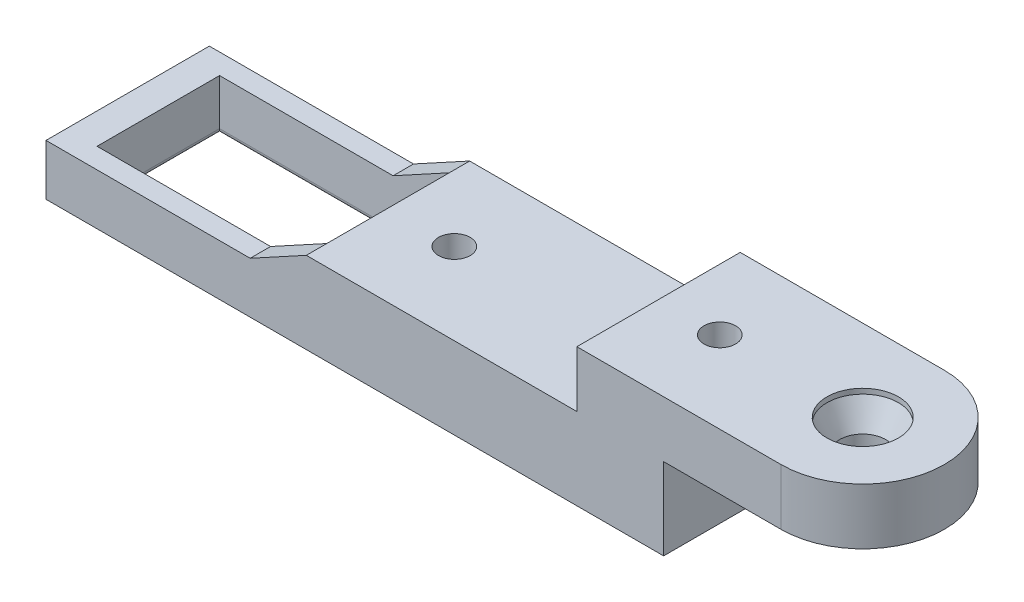
from build123d import *
from OCP.BRepFilletAPI import BRepFilletAPI_MakeChamfer

# Parameters (mm, degrees)
SKETCH1_W               = 34.25
SKETCH1_H               = 16
SKETCH1_W_2             = 22.5
SKETCH1_H_2             = 12
BOSS_EXTRUDE2_DEPTH     = 5
SKETCH4_W               = 16
SKETCH4_H               = 5
BOSS_EXTRUDE3_DEPTH     = 2
BOSS_EXTRUDE4_DEPTH     = 3
SKETCH6_R               = 1.55
CUT_EXTRUDE1_DEPTH      = 3.5
FILLET1_R               = 0.5
SKETCH8_W               = 25.75
SKETCH8_H               = 16
BOSS_EXTRUDE5_DEPTH     = 8
SKETCH9_W               = 10
SKETCH9_H               = 16
BOSS_EXTRUDE6_DEPTH     = 5.5
SKETCH10_R              = 1.55
CUT_EXTRUDE2_DEPTH      = 3.5
SKETCH11_W              = 16
SKETCH11_H              = 5.5
BOSS_EXTRUDE7_DEPTH     = 20
CUT_EXTRUDE3_DEPTH      = 70.543601431
CUT_EXTRUDE3_DEPTH_BACK = 70.543601431
SKETCH12_R              = 2.25
SKETCH13_R              = 3.5
CUT_EXTRUDE4_DEPTH      = 3
SKETCH14_W              = 1.5
SKETCH14_H              = 8
CUT_EXTRUDE5_DEPTH      = 70.002264456
CHAMFER1_SIZE2          = 1.25
CHAMFER1_SIZE           = 2.5
CHAMFER2_SIZE           = 5.5
CHAMFER2_SIZE_2         = 3


with BuildPart() as part:
    # Sketch1 → Boss-Extrude2 (new body)
    with BuildSketch(Plane(origin=(0, 0, 0), x_dir=(1, 0, 0), z_dir=(0, 1, 0))):
        with Locations((2.875, 0)):
            Rectangle(SKETCH1_W, SKETCH1_H)
        Rectangle(SKETCH1_W_2, SKETCH1_H_2, mode=Mode.SUBTRACT)
    extrude(amount=BOSS_EXTRUDE2_DEPTH)

    # Sketch4 → Boss-Extrude3 (add)
    with BuildSketch(Plane(origin=(20, 0, 0), x_dir=(0, 0, -1), z_dir=(1, 0, 0))):
        with Locations((0, 2.5)):
            Rectangle(SKETCH4_W, SKETCH4_H)
    extrude(amount=BOSS_EXTRUDE3_DEPTH)

    # Sketch3 → Boss-Extrude4 (add)
    with BuildSketch(Plane(origin=(0, 5, 0), x_dir=(1, 0, 0), z_dir=(0, 1, 0))):
        Polygon((5.75, 6), (11.25, 6), (11.25, -6), (5.75, -6), (5.75, -8), (22, -8), (22, 8), (5.75, 8), align=None)
    extrude(amount=BOSS_EXTRUDE4_DEPTH)

    # Sketch6 → Cut-Extrude1 (cut)
    with BuildSketch(Plane(origin=(0, 8, 0), x_dir=(1, 0, 0), z_dir=(0, 1, 0))):
        with Locations(Location((17.75, 0, 0), (0, 0, 270))):
            Circle(SKETCH6_R)
    extrude(amount=-CUT_EXTRUDE1_DEPTH, mode=Mode.SUBTRACT)

    # Fillet1
    fillet1_edges = [part.edges().sort_by_distance(p)[0] for p in [
        (11.25, 0, 0),
        (0, 0, -6),
        (-11.25, 0, 0),
        (0, 0, 6),
    ]]
    fillet(fillet1_edges, radius=FILLET1_R)

    # Sketch8 → Boss-Extrude5 (add)
    with BuildSketch(Plane(origin=(0, 8, 0), x_dir=(1, 0, 0), z_dir=(0, 1, 0))):
        with Locations((34.875, 0)):
            Rectangle(SKETCH8_W, SKETCH8_H)
    extrude(amount=-BOSS_EXTRUDE5_DEPTH)

    # Sketch9 → Boss-Extrude6 (add)
    with BuildSketch(Plane(origin=(0, 8, 0), x_dir=(1, 0, 0), z_dir=(0, 1, 0))):
        with Locations((42.75, 0)):
            Rectangle(SKETCH9_W, SKETCH9_H)
    extrude(amount=BOSS_EXTRUDE6_DEPTH)

    # Sketch10 → Cut-Extrude2 (cut)
    with BuildSketch(Plane(origin=(0, 13.5, 0), x_dir=(1, 0, 0), z_dir=(0, 1, 0))):
        with Locations(Location((43.75, 0, 0), (0, 0, 270))):
            Circle(SKETCH10_R)
    extrude(amount=-CUT_EXTRUDE2_DEPTH, mode=Mode.SUBTRACT)

    # Sketch11 → Boss-Extrude7 (add)
    with BuildSketch(Plane(origin=(47.75, 0, 0), x_dir=(0, 0, -1), z_dir=(1, 0, 0))):
        with Locations((0, 10.75)):
            Rectangle(SKETCH11_W, SKETCH11_H)
    extrude(amount=BOSS_EXTRUDE7_DEPTH)

    # Sketch12 → Cut-Extrude3 (cut, two sides: drawn at the far end of the back side and taken through both)
    with BuildSketch(Plane(origin=(0, 13.5, 0), x_dir=(1, 0, 0), z_dir=(0, 1, 0)).offset(-CUT_EXTRUDE3_DEPTH_BACK)):
        with Locations(Location((57.75, 0, 0), (0, 0, 270))):
            Circle(SKETCH12_R)
        with BuildLine():
            Line((57.75, 8), (67.75, 8))
            Line((67.75, 8), (67.75, -8))
            Line((67.75, -8), (57.75, -8))
            ThreePointArc((57.75, -8), (65.75, 0), (57.75, 8))
        make_face()
    extrude(amount=CUT_EXTRUDE3_DEPTH + CUT_EXTRUDE3_DEPTH_BACK, mode=Mode.SUBTRACT)

    # Sketch13 → Cut-Extrude4 (cut)
    with BuildSketch(Plane(origin=(0, 13.5, 0), x_dir=(1, 0, 0), z_dir=(0, 1, 0))):
        with Locations(Location((57.75, 0, 0), (0, 0, 270))):
            Circle(SKETCH13_R)
    extrude(amount=-CUT_EXTRUDE4_DEPTH, mode=Mode.SUBTRACT)

    # Sketch14 → Cut-Extrude5 (cut, through all)
    with BuildSketch(Plane(origin=(0, 0, -8), x_dir=(-1, 0, 0), z_dir=(0, 0, -1))):
        with Locations((-47, 4)):
            Rectangle(SKETCH14_W, SKETCH14_H)
    extrude(amount=-CUT_EXTRUDE5_DEPTH, mode=Mode.SUBTRACT)

    # Chamfer1
    chamfer1_edges = [part.edges().sort_by_distance(p)[0] for p in [
        (57.75, 10.5, -3.5),
    ]]
    chamfer1_side = [part.faces().sort_by_distance(p)[0] for p in [
        (57.75, 10.525, -3.5),
    ]]
    chamfer(chamfer1_edges, length=CHAMFER1_SIZE - 0.0001, length2=CHAMFER1_SIZE2 - 0.0001, reference=chamfer1_side[0])  # a hair under: the kernel refuses the full size

    # Chamfer2
    chamfer2_edges_1 = [part.edges().sort_by_distance(p)[0] for p in [
        (5.75, 8, 7),
    ]]
    chamfer2_side_1 = [part.faces().sort_by_distance(p)[0] for p in [
        (5.81, 8, 7),
    ]]
    chamfer2_edges_2 = [part.edges().sort_by_distance(p)[0] for p in [
        (5.75, 8, -7),
    ]]
    chamfer2_side_2 = [part.faces().sort_by_distance(p)[0] for p in [
        (5.81, 8, -7),
    ]]
    chamfer2 = BRepFilletAPI_MakeChamfer(part.part.solid().wrapped)
    for e in chamfer2_edges_1:
        chamfer2.Add(CHAMFER2_SIZE - 0.0001, CHAMFER2_SIZE_2 - 0.0001, e.wrapped, chamfer2_side_1[0].wrapped)
    for e in chamfer2_edges_2:
        chamfer2.Add(CHAMFER2_SIZE - 0.0001, CHAMFER2_SIZE_2 - 0.0001, e.wrapped, chamfer2_side_2[0].wrapped)
    add(Compound.cast(chamfer2.Shape()), mode=Mode.REPLACE)  # a hair under: the kernel refuses the full size


solid = part.part
